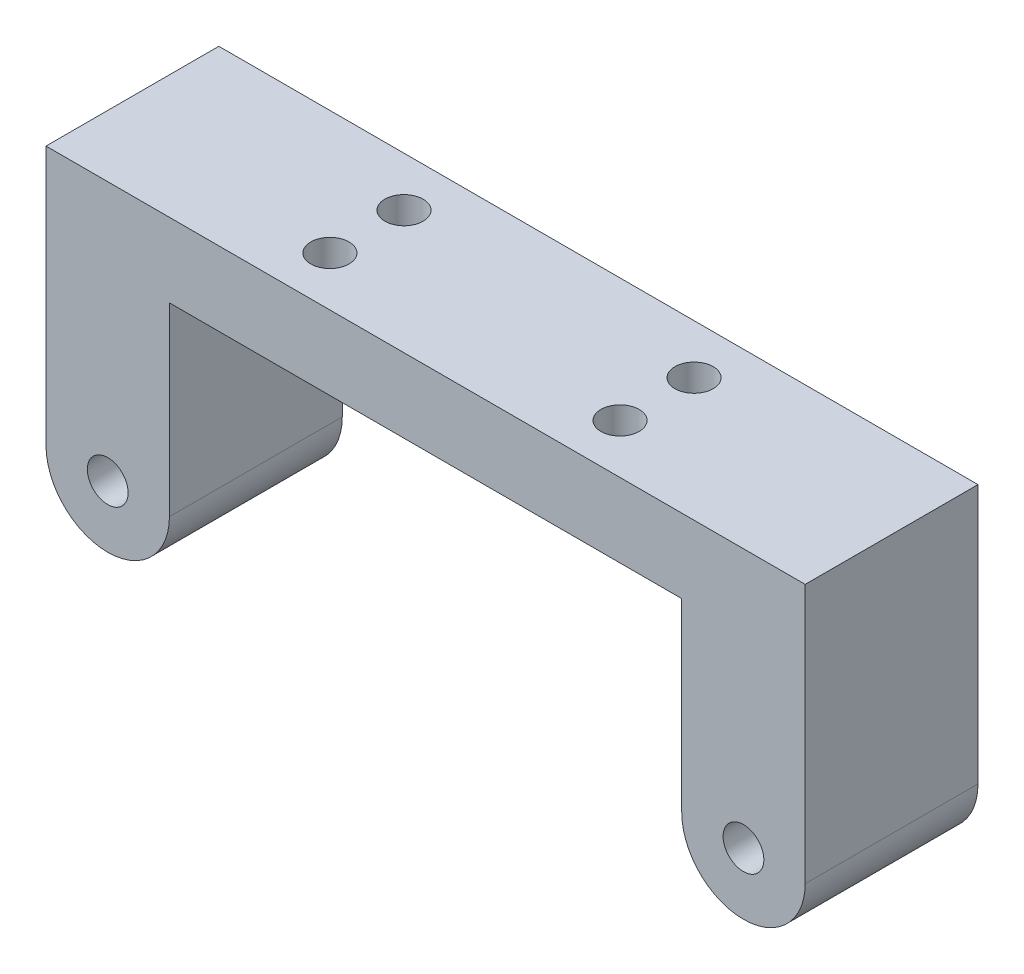
from build123d import *

# Parameters (mm, degrees)
SKETCH1_W           = 61.5
SKETCH1_H           = 14
BOSS_EXTRUDE1_DEPTH = 6
SKETCH2_R           = 1.55
CUT_EXTRUDE1_DEPTH  = 64.358109189
SKETCH3_W           = 10
SKETCH3_H           = 14
BOSS_EXTRUDE2_DEPTH = 20
SKETCH4_R           = 1.65
CUT_EXTRUDE2_DEPTH  = 67.168345906
FILLET1_R           = 5


with BuildPart() as part:
    # Sketch1 → Boss-Extrude1 (new body)
    with BuildSketch(Plane(origin=(0, 0, 0), x_dir=(1, 0, 0), z_dir=(0, 1, 0))):
        with Locations((30.75, -7)):
            Rectangle(SKETCH1_W, SKETCH1_H)
    extrude(amount=BOSS_EXTRUDE1_DEPTH)

    # Sketch2 → Cut-Extrude1 (cut, through all)
    with BuildSketch(Plane(origin=(0, 6, 0), x_dir=(1, 0, 0), z_dir=(0, 1, 0))):
        with Locations(Location((19, -4, 0), (0, 0, 270))):
            Circle(SKETCH2_R)
        with Locations(Location((42.5, -4, 0), (0, 0, 270))):
            Circle(SKETCH2_R)
        with Locations(Location((19, -10, 0), (0, 0, 270))):
            Circle(SKETCH2_R)
        with Locations(Location((42.5, -10, 0), (0, 0, 270))):
            Circle(SKETCH2_R)
    extrude(amount=-CUT_EXTRUDE1_DEPTH, mode=Mode.SUBTRACT)

    # Sketch3 → Boss-Extrude2 (add)
    with BuildSketch(Plane(origin=(0, 0, 0), x_dir=(-1, 0, 0), z_dir=(0, -1, 0))):
        with Locations((-5, -7)):
            Rectangle(SKETCH3_W, SKETCH3_H)
        with Locations((-56.5, -7)):
            Rectangle(SKETCH3_W, SKETCH3_H)
    extrude(amount=BOSS_EXTRUDE2_DEPTH)

    # Sketch4 → Cut-Extrude2 (cut, through all)
    with BuildSketch(Plane(origin=(0, 0, 0), x_dir=(-1, 0, 0), z_dir=(0, 0, -1))):
        with Locations((-5, -15)):
            Circle(SKETCH4_R)
        with Locations((-56.5, -15)):
            Circle(SKETCH4_R)
    extrude(amount=-CUT_EXTRUDE2_DEPTH, mode=Mode.SUBTRACT)

    # Fillet1
    fillet1_edges = [part.edges().sort_by_distance(p)[0] for p in [
        (10, -20, 7),
        (0, -20, 7),
        (51.5, -20, 7),
        (61.5, -20, 7),
    ]]
    fillet(fillet1_edges, radius=FILLET1_R - 0.0001)  # a hair under: the kernel refuses the full size


solid = part.part
